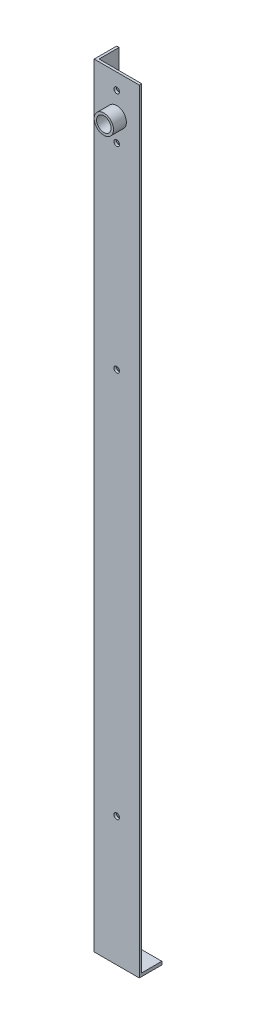
from build123d import *

# Parameters (mm, degrees)
SKETCH1_W           = 88.9
SKETCH1_H           = 44.45
BOSS_EXTRUDE1_DEPTH = 1524
CUT_EXTRUDE1_REACH  = 1527.296
SKETCH2_R           = 7.9375
SKETCH2_R_2         = 5.588
SKETCH4_R           = 19.05
SKETCH4_R_2         = 14.2875
BOSS_EXTRUDE2_DEPTH = 25.4
CUT_EXTRUDE3_REACH  = 1527.392
SKETCH7_W           = 88.9
SKETCH7_H           = 44.45
BOSS_EXTRUDE3_DEPTH = 6.35


with BuildPart() as part:
    # Sketch1 → Boss-Extrude1 (new body)
    with BuildSketch(Plane(origin=(0, 0, 0), x_dir=(1, 0, 0), z_dir=(0, 1, 0))):
        Rectangle(SKETCH1_W, SKETCH1_H)
    extrude(amount=BOSS_EXTRUDE1_DEPTH)

    # Sketch2 → Cut-Extrude1 (cut, up to next)
    with BuildSketch(Plane.XY.offset(22.225), mode=Mode.PRIVATE) as cut_extrude1_sk1:
        with Locations((0, 1447.8)):
            Circle(SKETCH2_R)
    cut_extrude1_tool1 = extrude(cut_extrude1_sk1.sketch, amount=-CUT_EXTRUDE1_REACH, mode=Mode.PRIVATE) & part.part
    # Sketch2 → Cut-Extrude1 (cut, up to next)
    with BuildSketch(Plane.XY.offset(22.225), mode=Mode.PRIVATE) as cut_extrude1_sk2:
        with Locations((0, 1016)):
            Circle(SKETCH2_R_2)
    cut_extrude1_tool2 = extrude(cut_extrude1_sk2.sketch, amount=-CUT_EXTRUDE1_REACH, mode=Mode.PRIVATE) & part.part
    # Sketch2 → Cut-Extrude1 (cut, up to next)
    with BuildSketch(Plane.XY.offset(22.225), mode=Mode.PRIVATE) as cut_extrude1_sk3:
        with Locations((0, 254)):
            Circle(SKETCH2_R_2)
    cut_extrude1_tool3 = extrude(cut_extrude1_sk3.sketch, amount=-CUT_EXTRUDE1_REACH, mode=Mode.PRIVATE) & part.part
    # Sketch2 → Cut-Extrude1 (cut, up to next)
    with BuildSketch(Plane.XY.offset(22.225), mode=Mode.PRIVATE) as cut_extrude1_sk4:
        with Locations((0, 1492.8453125)):
            Circle(SKETCH2_R_2)
    cut_extrude1_tool4 = extrude(cut_extrude1_sk4.sketch, amount=-CUT_EXTRUDE1_REACH, mode=Mode.PRIVATE) & part.part
    # Sketch2 → Cut-Extrude1 (cut, up to next)
    with BuildSketch(Plane.XY.offset(22.225), mode=Mode.PRIVATE) as cut_extrude1_sk5:
        with Locations((0, 1402.7546875)):
            Circle(SKETCH2_R_2)
    cut_extrude1_tool5 = extrude(cut_extrude1_sk5.sketch, amount=-CUT_EXTRUDE1_REACH, mode=Mode.PRIVATE) & part.part
    add(cut_extrude1_tool1.solids().sort_by_distance((0, 1447.8, 22.225))[0], mode=Mode.SUBTRACT)
    add(cut_extrude1_tool2.solids().sort_by_distance((0, 1016, 22.225))[0], mode=Mode.SUBTRACT)
    add(cut_extrude1_tool3.solids().sort_by_distance((0, 254, 22.225))[0], mode=Mode.SUBTRACT)
    add(cut_extrude1_tool4.solids().sort_by_distance((0, 1492.845313, 22.225))[0], mode=Mode.SUBTRACT)
    add(cut_extrude1_tool5.solids().sort_by_distance((0, 1402.754687, 22.225))[0], mode=Mode.SUBTRACT)

    # Sketch4 → Boss-Extrude2 (add)
    with BuildSketch(Plane.XY.offset(22.225)):
        with Locations((0, 1447.8)):
            Circle(SKETCH4_R)
        with Locations((0, 1447.8)):
            Circle(SKETCH4_R_2, mode=Mode.SUBTRACT)
    extrude(amount=BOSS_EXTRUDE2_DEPTH)

    # Sketch5 → Cut-Extrude3 (cut, up to next)
    with BuildSketch(Plane(origin=(0, 1524, 0), x_dir=(1, 0, 0), z_dir=(0, 1, 0)), mode=Mode.PRIVATE) as cut_extrude3_sk1:
        Polygon((-39.6875, 17.4625), (-39.6875, 22.225), (44.45, 22.225), (44.45, -17.4625), (39.6875, -17.4625), (-39.6875, -17.4625), align=None)
    cut_extrude3_tool1 = extrude(cut_extrude3_sk1.sketch, amount=-CUT_EXTRUDE3_REACH, mode=Mode.PRIVATE) & part.part
    add(cut_extrude3_tool1.solids().sort_by_distance((2.38125, 1524, -2.38125))[0], mode=Mode.SUBTRACT)

    # Sketch7 → Boss-Extrude3 (add)
    with BuildSketch(Plane.XZ):
        Rectangle(SKETCH7_W, SKETCH7_H)
    extrude(amount=-BOSS_EXTRUDE3_DEPTH)


solid = part.part
